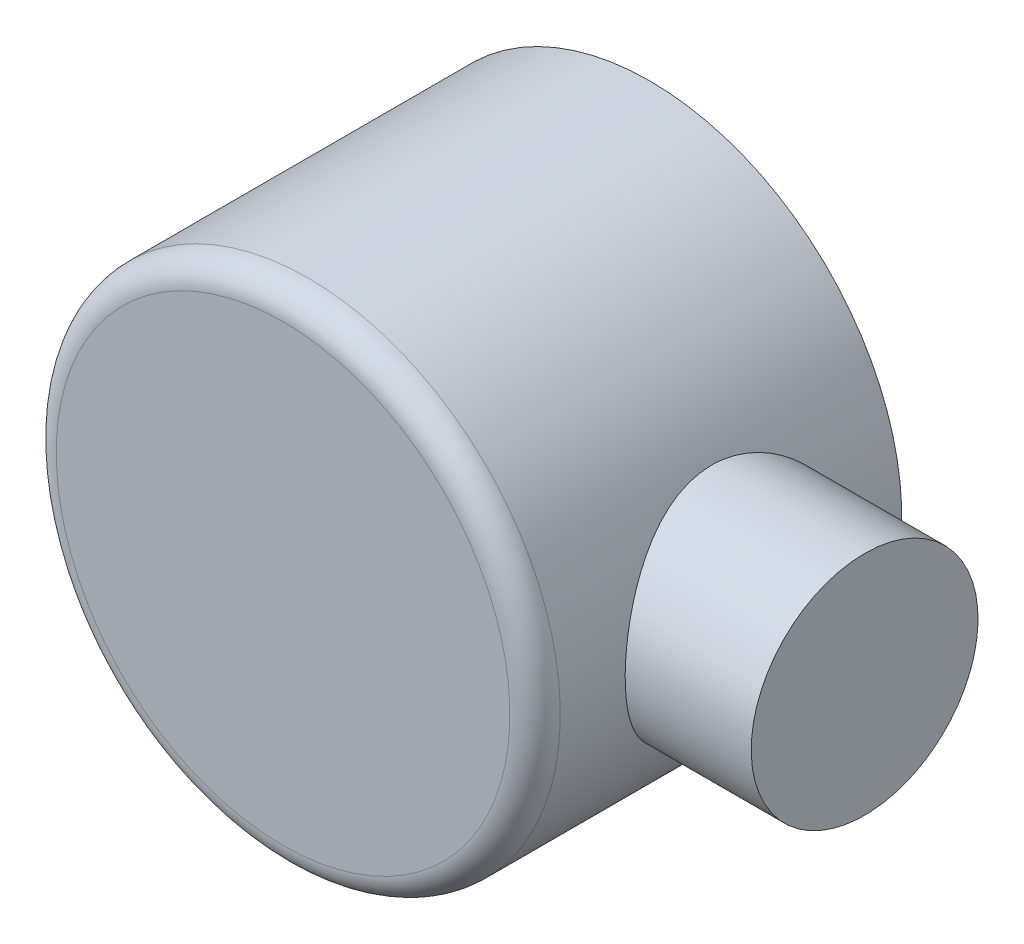
from build123d import *

# Parameters (mm, degrees)
SKETCH2_R             = 50
BOSS_EXTRUDE1_DEPTH   = 64.75
BOSS_EXTRUDE2_START   = 8
SKETCH4_R             = 50
BOSS_EXTRUDE2_DEPTH   = 8
FILLET1_R             = 5
BODY_MOVE_COPY2_ANGLE = 120


with BuildPart() as part:
    # Sketch2 → Boss-Extrude1 (new body)
    with BuildSketch(Plane(origin=(0, 0, 0), x_dir=(0, 0, -1), z_dir=(1, 0, 0))):
        Circle(SKETCH2_R)
    extrude(amount=BOSS_EXTRUDE1_DEPTH)

    # Sketch3 → Revolve1 (revolve)
    with BuildSketch(Plane.ZY.offset(-32.375)):
        with BuildLine():
            Line((0, 75), (0, 50))
            ThreePointArc((0, 50), (11.563490229, 48.644482665), (22.5, 44.651427749))
            Line((22.5, 44.651427749), (22.5, 75))
            Line((22.5, 75), (0, 75))
        make_face()
    revolve(axis=Axis((32.375, 50, 0), (0, 1, 0)))

    # Sketch4 → Boss-Extrude2 (add)
    with BuildSketch(Plane.ZY.offset(BOSS_EXTRUDE2_START)):
        Circle(SKETCH4_R)
    extrude(amount=-BOSS_EXTRUDE2_DEPTH)

    # Fillet1
    fillet1_edges = [part.edges().sort_by_distance(p)[0] for p in [
        (-8, 0, -50),
    ]]
    fillet(fillet1_edges, radius=FILLET1_R)


with BuildPart() as part_1:
    # Body-Move/Copy1: moved
    add(part.part.moved(Location((-32.38, 0, 0))))


with BuildPart() as part_2:
    # Body-Move/Copy2: moved
    add(part_1.part.rotate(Axis((0, 0, 0), (0.5773502691896272, 0.5773502691896252, -0.5773502691896252)), BODY_MOVE_COPY2_ANGLE))


solid = part_2.part
